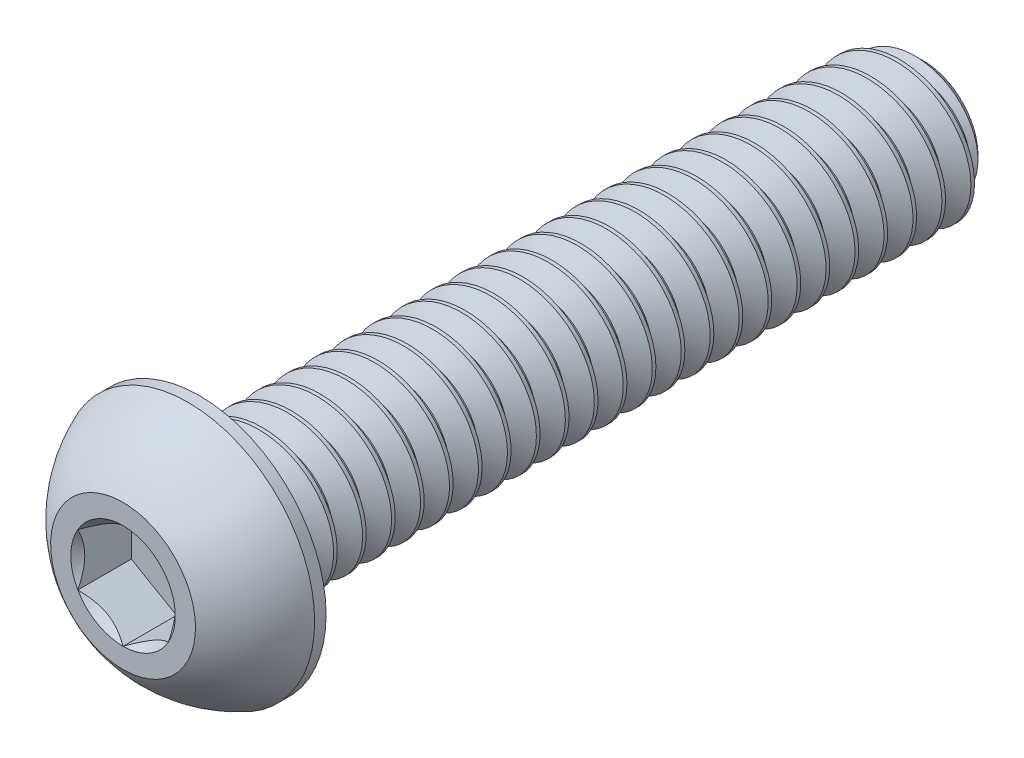
from build123d import *

# Parameters (mm, degrees)
SKETCH11_W         = 31.75
SKETCH11_H         = 3.175
CHAMFER1_SIZE      = 0.79375
CUT_EXTRUDE2_DEPTH = 2.34696
CUT_SWEEP1_PITCH   = 1.27


with BuildPart() as part:
    # Sketch11 → Revolve1 (revolve)
    with BuildSketch(Plane(origin=(0, 0, 0), x_dir=(0, 0, -1), z_dir=(1, 0, 0)), mode=Mode.PRIVATE) as revolve1_sk:
        with Locations((19.2278, 1.5875)):
            Rectangle(SKETCH11_W, SKETCH11_H)
    revolve(revolve1_sk.sketch.rotate(Axis((0, 0, -3.3528), (0, 0, -1)), 180), axis=Axis((0, 0, -3.3528), (0, 0, -1)))

    # Chamfer1
    chamfer1_edges = [part.edges().sort_by_distance(p)[0] for p in [
        (0, 3.175, -35.1028),
    ]]
    chamfer(chamfer1_edges, length=CHAMFER1_SIZE)

    # Cut-Sweep1: the profile of Sketch2 screwed along a right-hand helix of 26 turns, 8 arcs to a turn; built about Z, then put on its axis
    cut_sweep1_z = Axis((0, 0, 0), (0, 0, 1))
    cut_sweep1_corners = [(3.243740766, 0, 0.0396875), (3.243740766, 0, -1.1509375), (2.350110803, 0, -0.635), (2.350110803, 0, -0.47625)]
    with BuildLine(mode=Mode.PRIVATE) as cut_sweep1_profile:
        Line(cut_sweep1_corners[0], cut_sweep1_corners[1])
        Line(cut_sweep1_corners[1], cut_sweep1_corners[2])
        Line(cut_sweep1_corners[2], cut_sweep1_corners[3])
        Line(cut_sweep1_corners[3], cut_sweep1_corners[0])
    cut_sweep1_cap = Face(cut_sweep1_profile.wire())
    cut_sweep1_turn_angles = [0, 22.5, 45, 67.5, 90, 112.5, 135, 157.5, 180, 202.5, 225, 247.5, 270, 292.5, 315, 337.5, 360]
    cut_sweep1_turn_weights = [1, 0.9238795325112867, 1, 0.9238795325112867, 1, 0.9238795325112867, 1, 0.9238795325112867, 1, 0.9238795325112867, 1, 0.9238795325112867, 1, 0.9238795325112867, 1, 0.9238795325112867, 1]
    cut_sweep1_turn_rails = [Edge.make_bspline([Vector(p[0], p[1], 0).rotate(cut_sweep1_z, cut_sweep1_turn_angles[k]) / cut_sweep1_turn_weights[k] + Vector(0, 0, p[2] + CUT_SWEEP1_PITCH * cut_sweep1_turn_angles[k] / 360) for k in range(17)], [0, 0, 0, 1, 1, 2, 2, 3, 3, 4, 4, 5, 5, 6, 6, 7, 7, 8, 8, 8], 2, cut_sweep1_turn_weights) for p in cut_sweep1_corners]
    cut_sweep1_turn_sides = [Face.make_surface_from_curves(cut_sweep1_turn_rails[p[0]], cut_sweep1_turn_rails[p[1]]) for p in [(0, 1), (1, 2), (2, 3), (3, 0)]]
    cut_sweep1 = Plane(origin=(0, 0, -35.1028), x_dir=(0, 1, 0), z_dir=(0, 0, 1)) * Solid(Shell([*[p.moved(Location((0, 0, CUT_SWEEP1_PITCH * i))) for i in range(26) for p in cut_sweep1_turn_sides], cut_sweep1_cap, cut_sweep1_cap.rotate(cut_sweep1_z, 9360).moved(Location((0, 0, CUT_SWEEP1_PITCH * 9360 / 360)))]))
    add(cut_sweep1, mode=Mode.SUBTRACT)


with BuildPart() as body_2:
    # Sketch7 → Revolve2 (revolve)
    with BuildSketch(Plane(origin=(0, 0, 0), x_dir=(0, 0, -1), z_dir=(1, 0, 0)), mode=Mode.PRIVATE) as revolve2_sk:
        with BuildLine():
            Line((2.84988, 5.5499), (3.3528, 5.5499))
            Line((3.3528, 5.5499), (3.3528, 0))
            Line((3.3528, 0), (0, 0))
            Line((0, 0), (0, 3.175))
            ThreePointArc((0, 3.175), (1.235921075, 4.58927271), (2.84988, 5.5499))
        make_face()
    revolve(revolve2_sk.sketch.rotate(Axis((0, 0, 0), (0, 0, -1)), 180), axis=Axis((0, 0, 0), (0, 0, -1)))

    # Sketch5 → Cut-Extrude2 (cut)
    with BuildSketch(Plane.XY):
        Polygon((1.984375, -1.14567944), (1.984375, 1.14567944), (0, 2.291358881), (-1.984375, 1.14567944), (-1.984375, -1.14567944), (0, -2.291358881), align=None)
    extrude(amount=-CUT_EXTRUDE2_DEPTH, mode=Mode.SUBTRACT)

    # Cut-Extrude3 cone 1 section (through the dimple's axis) → Cut-Extrude3 (revolve, cut)
    with BuildSketch(Plane(origin=(0, 0, 0), x_dir=(0, -1, 0), z_dir=(1, 0, 0))):
        Polygon((0, 0), (2.291358881, 0), (0, 2.291358881), align=None)
    revolve(axis=Axis((0, 0, 0), (0, 0, -1)), mode=Mode.SUBTRACT)


solid = Compound([part.part, body_2.part])
